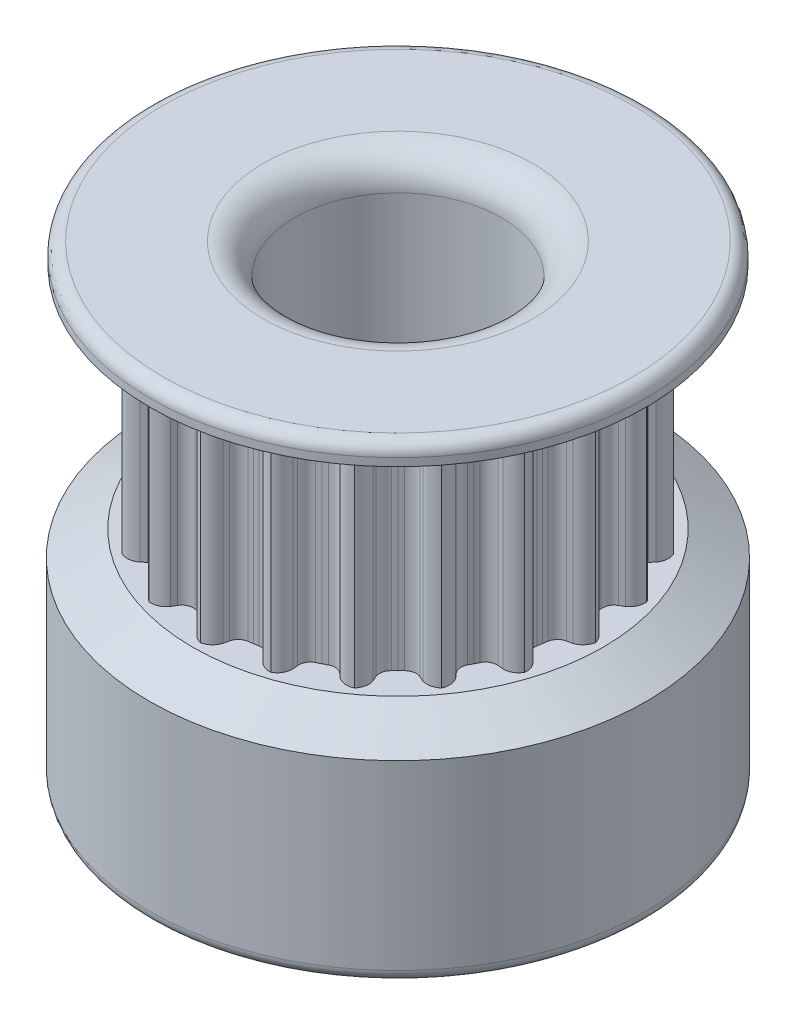
from build123d import *
from OCP.BRepFilletAPI import BRepFilletAPI_MakeChamfer

# Parameters (mm, degrees)
ESQUISSE1_R             = 7.935
BOSS_EXTRU_1_DEPTH      = 7
BOSS_EXTRU_2_DEPTH      = 6.5
ESQUISSE3_R             = 7.9
BOSS_EXTRU_3_DEPTH      = 1.45
ENL_V_MAT_EXTRU_1_REACH = 20.693
ESQUISSE4_R             = 3.3
ESQUISSE5_R             = 1.65
ENL_V_MAT_EXTRU_2_DEPTH = 19.693072246
CONG_1_R                = 1
CONG_2_R                = 0.4
CONG_3_R                = 0.4
CHANFREIN1_SIZE         = 0.8
CHANFREIN1_SIZE2        = 1.385640646


with BuildPart() as part:
    # Esquisse1 → Boss.-Extru.1 (new body)
    with BuildSketch(Plane(origin=(0, 0, 0), x_dir=(1, 0, 0), z_dir=(0, 1, 0))):
        Circle(ESQUISSE1_R)
    extrude(amount=BOSS_EXTRU_1_DEPTH)

    # Esquisse2 → Boss.-Extru.2 (add)
    with BuildSketch(Plane(origin=(0, 7, 0), x_dir=(1, 0, 0), z_dir=(0, 1, 0))):
        with BuildLine():
            Line((-0.868138245, 5.481209159), (-0.719748925, 5.503131971))
            ThreePointArc((-0.719748925, 5.503131971), (-0.521045533, 5.598969318), (-0.412205098, 5.790858857))
            Line((-0.412205098, 5.790858857), (-0.376144996, 5.957398329))
            ThreePointArc((-0.376144996, 5.957398329), (-0.234907555, 6.180119732), (0, 6.3))
            ThreePointArc((0, 6.3), (0.234907555, 6.180119732), (0.376144996, 5.957398329))
            Line((0.376144996, 5.957398329), (0.412205098, 5.790858857))
            ThreePointArc((0.412205098, 5.790858857), (0.521045533, 5.598969318), (0.719748925, 5.503131971))
            Line((0.719748925, 5.503131971), (0.868138245, 5.481209159))
            Line((0.868138245, 5.481209159), (1.016039396, 5.45620417))
            ThreePointArc((1.016039396, 5.45620417), (1.234632921, 5.485948179), (1.397443454, 5.634812432))
            Line((1.397443454, 5.634812432), (1.483202177, 5.782057697))
            ThreePointArc((1.483202177, 5.782057697), (1.686351664, 5.950233569), (1.946807065, 5.991656053))
            ThreePointArc((1.946807065, 5.991656053), (2.133172385, 5.805052716), (2.198672475, 5.549587305))
            Line((2.198672475, 5.549587305), (2.181504144, 5.380055671))
            ThreePointArc((2.181504144, 5.380055671), (2.225720419, 5.16392433), (2.385083206, 5.011374871))
            Line((2.385083206, 5.011374871), (2.519435315, 4.944670216))
            Line((2.519435315, 4.944670216), (2.652370702, 4.87518509))
            ThreePointArc((2.652370702, 4.87518509), (2.869456903, 4.835924209), (3.070300505, 4.927191305))
            Line((3.070300505, 4.927191305), (3.197363186, 5.040728972))
            ThreePointArc((3.197363186, 5.040728972), (3.442539032, 5.137897086), (3.703047089, 5.096807065))
            ThreePointArc((3.703047089, 5.096807065), (3.822627439, 4.861746694), (3.805978574, 4.59854401))
            Line((3.805978574, 4.59854401), (3.737262364, 4.44261515))
            ThreePointArc((3.737262364, 4.44261515), (3.712526284, 4.22339845), (3.816948926, 4.029069483))
            Line((3.816948926, 4.029069483), (3.924112502, 3.924112502))
            Line((3.924112502, 3.924112502), (4.029069483, 3.816948926))
            ThreePointArc((4.029069483, 3.816948926), (4.22339845, 3.712526284), (4.44261515, 3.737262364))
            Line((4.44261515, 3.737262364), (4.59854401, 3.805978574))
            ThreePointArc((4.59854401, 3.805978574), (4.861746694, 3.822627439), (5.096807065, 3.703047089))
            ThreePointArc((5.096807065, 3.703047089), (5.137897086, 3.442539032), (5.040728972, 3.197363186))
            Line((5.040728972, 3.197363186), (4.927191305, 3.070300505))
            ThreePointArc((4.927191305, 3.070300505), (4.835924209, 2.869456903), (4.87518509, 2.652370702))
            Line((4.87518509, 2.652370702), (4.944670216, 2.519435315))
            Line((4.944670216, 2.519435315), (5.011374871, 2.385083206))
            ThreePointArc((5.011374871, 2.385083206), (5.16392433, 2.225720419), (5.380055671, 2.181504144))
            Line((5.380055671, 2.181504144), (5.549587305, 2.198672475))
            ThreePointArc((5.549587305, 2.198672475), (5.805052716, 2.133172385), (5.991656053, 1.946807065))
            ThreePointArc((5.991656053, 1.946807065), (5.950233569, 1.686351664), (5.782057697, 1.483202177))
            Line((5.782057697, 1.483202177), (5.634812432, 1.397443454))
            ThreePointArc((5.634812432, 1.397443454), (5.485948179, 1.234632921), (5.45620417, 1.016039396))
            Line((5.45620417, 1.016039396), (5.481209159, 0.868138245))
            Line((5.481209159, 0.868138245), (5.503131971, 0.719748925))
            ThreePointArc((5.503131971, 0.719748925), (5.598969318, 0.521045533), (5.790858857, 0.412205098))
            Line((5.790858857, 0.412205098), (5.957398329, 0.376144996))
            ThreePointArc((5.957398329, 0.376144996), (6.180119732, 0.234907555), (6.3, 0))
            ThreePointArc((6.3, 0), (6.180119732, -0.234907555), (5.957398329, -0.376144996))
            Line((5.957398329, -0.376144996), (5.790858857, -0.412205098))
            ThreePointArc((5.790858857, -0.412205098), (5.598969318, -0.521045533), (5.503131971, -0.719748925))
            Line((5.503131971, -0.719748925), (5.481209159, -0.868138245))
            Line((5.481209159, -0.868138245), (5.45620417, -1.016039396))
            ThreePointArc((5.45620417, -1.016039396), (5.485948179, -1.234632921), (5.634812432, -1.397443454))
            Line((5.634812432, -1.397443454), (5.782057697, -1.483202177))
            ThreePointArc((5.782057697, -1.483202177), (5.950233569, -1.686351664), (5.991656053, -1.946807065))
            ThreePointArc((5.991656053, -1.946807065), (5.805052716, -2.133172385), (5.549587305, -2.198672475))
            Line((5.549587305, -2.198672475), (5.380055671, -2.181504144))
            ThreePointArc((5.380055671, -2.181504144), (5.16392433, -2.225720419), (5.011374871, -2.385083206))
            Line((5.011374871, -2.385083206), (4.944670216, -2.519435315))
            Line((4.944670216, -2.519435315), (4.87518509, -2.652370702))
            ThreePointArc((4.87518509, -2.652370702), (4.835924209, -2.869456903), (4.927191305, -3.070300505))
            Line((4.927191305, -3.070300505), (5.040728972, -3.197363186))
            ThreePointArc((5.040728972, -3.197363186), (5.137897086, -3.442539032), (5.096807065, -3.703047089))
            ThreePointArc((5.096807065, -3.703047089), (4.861746694, -3.822627439), (4.59854401, -3.805978574))
            Line((4.59854401, -3.805978574), (4.44261515, -3.737262364))
            ThreePointArc((4.44261515, -3.737262364), (4.22339845, -3.712526284), (4.029069483, -3.816948926))
            Line((4.029069483, -3.816948926), (3.924112502, -3.924112502))
            Line((3.924112502, -3.924112502), (3.816948926, -4.029069483))
            ThreePointArc((3.816948926, -4.029069483), (3.712526284, -4.22339845), (3.737262364, -4.44261515))
            Line((3.737262364, -4.44261515), (3.805978574, -4.59854401))
            ThreePointArc((3.805978574, -4.59854401), (3.822627439, -4.861746694), (3.703047089, -5.096807065))
            ThreePointArc((3.703047089, -5.096807065), (3.442539032, -5.137897086), (3.197363186, -5.040728972))
            Line((3.197363186, -5.040728972), (3.070300505, -4.927191305))
            ThreePointArc((3.070300505, -4.927191305), (2.869456903, -4.835924209), (2.652370702, -4.87518509))
            Line((2.652370702, -4.87518509), (2.519435315, -4.944670216))
            Line((2.519435315, -4.944670216), (2.385083206, -5.011374871))
            ThreePointArc((2.385083206, -5.011374871), (2.225720419, -5.16392433), (2.181504144, -5.380055671))
            Line((2.181504144, -5.380055671), (2.198672475, -5.549587305))
            ThreePointArc((2.198672475, -5.549587305), (2.133172385, -5.805052716), (1.946807065, -5.991656053))
            ThreePointArc((1.946807065, -5.991656053), (1.686351664, -5.950233569), (1.483202177, -5.782057697))
            Line((1.483202177, -5.782057697), (1.397443454, -5.634812432))
            ThreePointArc((1.397443454, -5.634812432), (1.234632921, -5.485948179), (1.016039396, -5.45620417))
            Line((1.016039396, -5.45620417), (0.868138245, -5.481209159))
            Line((0.868138245, -5.481209159), (0.719748925, -5.503131971))
            ThreePointArc((0.719748925, -5.503131971), (0.521045533, -5.598969318), (0.412205098, -5.790858857))
            Line((0.412205098, -5.790858857), (0.376144996, -5.957398329))
            ThreePointArc((0.376144996, -5.957398329), (0.234907555, -6.180119732), (0, -6.3))
            ThreePointArc((0, -6.3), (-0.234907555, -6.180119732), (-0.376144996, -5.957398329))
            Line((-0.376144996, -5.957398329), (-0.412205098, -5.790858857))
            ThreePointArc((-0.412205098, -5.790858857), (-0.521045533, -5.598969318), (-0.719748925, -5.503131971))
            Line((-0.719748925, -5.503131971), (-0.868138245, -5.481209159))
            Line((-0.868138245, -5.481209159), (-1.016039396, -5.45620417))
            ThreePointArc((-1.016039396, -5.45620417), (-1.234632921, -5.485948179), (-1.397443454, -5.634812432))
            Line((-1.397443454, -5.634812432), (-1.483202177, -5.782057697))
            ThreePointArc((-1.483202177, -5.782057697), (-1.686351664, -5.950233569), (-1.946807065, -5.991656053))
            ThreePointArc((-1.946807065, -5.991656053), (-2.133172385, -5.805052716), (-2.198672475, -5.549587305))
            Line((-2.198672475, -5.549587305), (-2.181504144, -5.380055671))
            ThreePointArc((-2.181504144, -5.380055671), (-2.225720419, -5.16392433), (-2.385083206, -5.011374871))
            Line((-2.385083206, -5.011374871), (-2.519435315, -4.944670216))
            Line((-2.519435315, -4.944670216), (-2.652370702, -4.87518509))
            ThreePointArc((-2.652370702, -4.87518509), (-2.869456903, -4.835924209), (-3.070300505, -4.927191305))
            Line((-3.070300505, -4.927191305), (-3.197363186, -5.040728972))
            ThreePointArc((-3.197363186, -5.040728972), (-3.442539032, -5.137897086), (-3.703047089, -5.096807065))
            ThreePointArc((-3.703047089, -5.096807065), (-3.822627439, -4.861746694), (-3.805978574, -4.59854401))
            Line((-3.805978574, -4.59854401), (-3.737262364, -4.44261515))
            ThreePointArc((-3.737262364, -4.44261515), (-3.712526284, -4.22339845), (-3.816948926, -4.029069483))
            Line((-3.816948926, -4.029069483), (-3.924112502, -3.924112502))
            Line((-3.924112502, -3.924112502), (-4.029069483, -3.816948926))
            ThreePointArc((-4.029069483, -3.816948926), (-4.22339845, -3.712526284), (-4.44261515, -3.737262364))
            Line((-4.44261515, -3.737262364), (-4.59854401, -3.805978574))
            ThreePointArc((-4.59854401, -3.805978574), (-4.861746694, -3.822627439), (-5.096807065, -3.703047089))
            ThreePointArc((-5.096807065, -3.703047089), (-5.137897086, -3.442539032), (-5.040728972, -3.197363186))
            Line((-5.040728972, -3.197363186), (-4.927191305, -3.070300505))
            ThreePointArc((-4.927191305, -3.070300505), (-4.835924209, -2.869456903), (-4.87518509, -2.652370702))
            Line((-4.87518509, -2.652370702), (-4.944670216, -2.519435315))
            Line((-4.944670216, -2.519435315), (-5.011374871, -2.385083206))
            ThreePointArc((-5.011374871, -2.385083206), (-5.16392433, -2.225720419), (-5.380055671, -2.181504144))
            Line((-5.380055671, -2.181504144), (-5.549587305, -2.198672475))
            ThreePointArc((-5.549587305, -2.198672475), (-5.805052716, -2.133172385), (-5.991656053, -1.946807065))
            ThreePointArc((-5.991656053, -1.946807065), (-5.950233569, -1.686351664), (-5.782057697, -1.483202177))
            Line((-5.782057697, -1.483202177), (-5.634812432, -1.397443454))
            ThreePointArc((-5.634812432, -1.397443454), (-5.485948179, -1.234632921), (-5.45620417, -1.016039396))
            Line((-5.45620417, -1.016039396), (-5.481209159, -0.868138245))
            Line((-5.481209159, -0.868138245), (-5.503131971, -0.719748925))
            ThreePointArc((-5.503131971, -0.719748925), (-5.598969318, -0.521045533), (-5.790858857, -0.412205098))
            Line((-5.790858857, -0.412205098), (-5.957398329, -0.376144996))
            ThreePointArc((-5.957398329, -0.376144996), (-6.180119732, -0.234907555), (-6.3, 0))
            ThreePointArc((-6.3, 0), (-6.180119732, 0.234907555), (-5.957398329, 0.376144996))
            Line((-5.957398329, 0.376144996), (-5.790858857, 0.412205098))
            ThreePointArc((-5.790858857, 0.412205098), (-5.598969318, 0.521045533), (-5.503131971, 0.719748925))
            Line((-5.503131971, 0.719748925), (-5.481209159, 0.868138245))
            Line((-5.481209159, 0.868138245), (-5.45620417, 1.016039396))
            ThreePointArc((-5.45620417, 1.016039396), (-5.485948179, 1.234632921), (-5.634812432, 1.397443454))
            Line((-5.634812432, 1.397443454), (-5.782057697, 1.483202177))
            ThreePointArc((-5.782057697, 1.483202177), (-5.950233569, 1.686351664), (-5.991656053, 1.946807065))
            ThreePointArc((-5.991656053, 1.946807065), (-5.805052716, 2.133172385), (-5.549587305, 2.198672475))
            Line((-5.549587305, 2.198672475), (-5.380055671, 2.181504144))
            ThreePointArc((-5.380055671, 2.181504144), (-5.16392433, 2.225720419), (-5.011374871, 2.385083206))
            Line((-5.011374871, 2.385083206), (-4.944670216, 2.519435315))
            Line((-4.944670216, 2.519435315), (-4.87518509, 2.652370702))
            ThreePointArc((-4.87518509, 2.652370702), (-4.835924209, 2.869456903), (-4.927191305, 3.070300505))
            Line((-4.927191305, 3.070300505), (-5.040728972, 3.197363186))
            ThreePointArc((-5.040728972, 3.197363186), (-5.137897086, 3.442539032), (-5.096807065, 3.703047089))
            ThreePointArc((-5.096807065, 3.703047089), (-4.861746694, 3.822627439), (-4.59854401, 3.805978574))
            Line((-4.59854401, 3.805978574), (-4.44261515, 3.737262364))
            ThreePointArc((-4.44261515, 3.737262364), (-4.22339845, 3.712526284), (-4.029069483, 3.816948926))
            Line((-4.029069483, 3.816948926), (-3.924112502, 3.924112502))
            Line((-3.924112502, 3.924112502), (-3.816948926, 4.029069483))
            ThreePointArc((-3.816948926, 4.029069483), (-3.712526284, 4.22339845), (-3.737262364, 4.44261515))
            Line((-3.737262364, 4.44261515), (-3.805978574, 4.59854401))
            ThreePointArc((-3.805978574, 4.59854401), (-3.822627439, 4.861746694), (-3.703047089, 5.096807065))
            ThreePointArc((-3.703047089, 5.096807065), (-3.442539032, 5.137897086), (-3.197363186, 5.040728972))
            Line((-3.197363186, 5.040728972), (-3.070300505, 4.927191305))
            ThreePointArc((-3.070300505, 4.927191305), (-2.869456903, 4.835924209), (-2.652370702, 4.87518509))
            Line((-2.652370702, 4.87518509), (-2.519435315, 4.944670216))
            Line((-2.519435315, 4.944670216), (-2.385083206, 5.011374871))
            ThreePointArc((-2.385083206, 5.011374871), (-2.225720419, 5.16392433), (-2.181504144, 5.380055671))
            Line((-2.181504144, 5.380055671), (-2.198672475, 5.549587305))
            ThreePointArc((-2.198672475, 5.549587305), (-2.133172385, 5.805052716), (-1.946807065, 5.991656053))
            ThreePointArc((-1.946807065, 5.991656053), (-1.686351664, 5.950233569), (-1.483202177, 5.782057697))
            Line((-1.483202177, 5.782057697), (-1.397443454, 5.634812432))
            ThreePointArc((-1.397443454, 5.634812432), (-1.234632921, 5.485948179), (-1.016039396, 5.45620417))
            Line((-1.016039396, 5.45620417), (-0.868138245, 5.481209159))
        make_face()
    extrude(amount=BOSS_EXTRU_2_DEPTH)

    # Esquisse3 → Boss.-Extru.3 (add)
    with BuildSketch(Plane(origin=(0, 13.5, 0), x_dir=(1, 0, 0), z_dir=(0, 1, 0))):
        Circle(ESQUISSE3_R)
    extrude(amount=BOSS_EXTRU_3_DEPTH)

    # Esquisse4 → Enlèv. mat.-Extru.1 (cut, up to next)
    with BuildSketch(Plane(origin=(0, 14.95, 0), x_dir=(1, 0, 0), z_dir=(0, 1, 0)), mode=Mode.PRIVATE) as enl_v_mat_extru_1_sk1:
        Circle(ESQUISSE4_R)
    enl_v_mat_extru_1_tool1 = extrude(enl_v_mat_extru_1_sk1.sketch, amount=-ENL_V_MAT_EXTRU_1_REACH, mode=Mode.PRIVATE) & part.part
    add(enl_v_mat_extru_1_tool1.solids().sort_by_distance((0, 14.95, 0))[0], mode=Mode.SUBTRACT)

    # Esquisse5 → Enlèv. mat.-Extru.2 (cut, through all)
    with BuildSketch(Plane.XY):
        with Locations((0, 3.75)):
            Circle(ESQUISSE5_R)
    extrude(amount=-ENL_V_MAT_EXTRU_2_DEPTH, mode=Mode.SUBTRACT)

    # Congé1
    cong_1_edges = [part.edges().sort_by_distance(p)[0] for p in [
        (-3.3, 14.95, 0),
        (-3.3, 0, 0),
    ]]
    fillet(cong_1_edges, radius=CONG_1_R)

    # Congé2
    cong_2_edges = [part.edges().sort_by_distance(p)[0] for p in [
        (-1.650000006, 3.750000002, -7.761554291),
    ]]
    fillet(cong_2_edges, radius=CONG_2_R)

    # Congé3
    cong_3_edges = [part.edges().sort_by_distance(p)[0] for p in [
        (-7.9, 14.95, 0),
        (-7.935, 0, 0),
    ]]
    fillet(cong_3_edges, radius=CONG_3_R)

    # Chanfrein1: one chamfer whose edges measure the first distance from different faces: ONE call of the kernel's chamfer builder (chamfer() names one face for all edges)
    chanfrein1_edges_1 = [part.edges().sort_by_distance(p)[0] for p in [
        (-7.935, 7, 0),
    ]]
    chanfrein1_side_1 = [part.faces().sort_by_distance(p)[0] for p in [
        (-7.935, 3.7, 0),
    ]]
    chanfrein1_edges_2 = [part.edges().sort_by_distance(p)[0] for p in [
        (-7.9, 13.5, 0),
    ]]
    chanfrein1_side_2 = [part.faces().sort_by_distance(p)[0] for p in [
        (-7.9, 14.025, 0),
    ]]
    chanfrein1 = BRepFilletAPI_MakeChamfer(part.part.solid().wrapped)
    for e in chanfrein1_edges_1:
        chanfrein1.Add(CHANFREIN1_SIZE, CHANFREIN1_SIZE2, e.wrapped, chanfrein1_side_1[0].wrapped)  # the first distance lies on this face
    for e in chanfrein1_edges_2:
        chanfrein1.Add(CHANFREIN1_SIZE, CHANFREIN1_SIZE2, e.wrapped, chanfrein1_side_2[0].wrapped)  # the first distance lies on this face
    add(Compound.cast(chanfrein1.Shape()), mode=Mode.REPLACE)


solid = part.part
